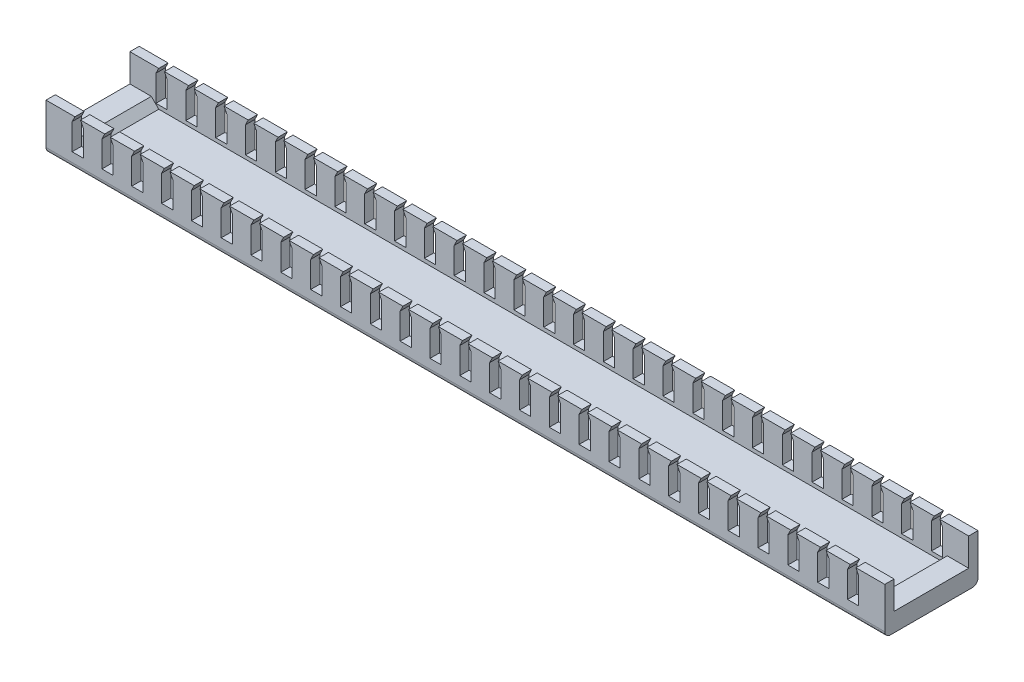
from build123d import *

# Parameters (mm, degrees)
PROFILEBOSS_EXTRUDE1_DEPTH             = 225
SPIKESCUT_EXTRUDE1_DEPTH               = 227.72946434
MOUNTHOLETHICKNESSSKETCH4_W            = 7.75
MOUNTHOLETHICKNESSSKETCH4_H            = 20
MOUNTHOLESTHICKNESSBOSS_EXTRUDE1_DEPTH = 2
MOUNTHOLESSKETCH5_R                    = 2.05
MOUNTHOLESCUT_EXTRUDE2_DEPTH           = 4
CHAMFER1_SIZE                          = 2


with BuildPart() as part:
    # Sketch2 → ProfileBoss-Extrude1 (new body)
    with BuildSketch(Plane(origin=(0, 0, 0), x_dir=(0, 0, -1), z_dir=(1, 0, 0))):
        with BuildLine():
            Line((1.5, 0), (23.5, 0))
            ThreePointArc((23.5, 0), (24.560660172, 0.439339828), (25, 1.5))
            Line((25, 1.5), (25, 12.5))
            Line((25, 12.5), (22.5, 12.5))
            Line((22.5, 12.5), (22.5, 3))
            Line((22.5, 3), (2.5, 3))
            Line((2.5, 3), (2.5, 12.5))
            Line((2.5, 12.5), (0, 12.5))
            Line((0, 12.5), (0, 1.5))
            ThreePointArc((0, 1.5), (0.439339828, 0.439339828), (1.5, 0))
        make_face()
    extrude(amount=PROFILEBOSS_EXTRUDE1_DEPTH)

    # Sketch3 → SpikesCut-Extrude1 (cut, through all)
    with BuildSketch(Plane.XY):
        Polygon((7.75, 12.5), (7, 11), (7, 4), (10, 4), (10, 11), (9.25, 12.5), align=None)
        Polygon((15.75, 12.5), (15, 11), (15, 4), (18, 4), (18, 11), (17.25, 12.5), align=None)
        Polygon((23.75, 12.5), (23, 11), (23, 4), (26, 4), (26, 11), (25.25, 12.5), align=None)
        Polygon((31.75, 12.5), (31, 11), (31, 4), (34, 4), (34, 11), (33.25, 12.5), align=None)
        Polygon((39.75, 12.5), (39, 11), (39, 4), (42, 4), (42, 11), (41.25, 12.5), align=None)
        Polygon((47.75, 12.5), (47, 11), (47, 4), (50, 4), (50, 11), (49.25, 12.5), align=None)
        Polygon((55.75, 12.5), (55, 11), (55, 4), (58, 4), (58, 11), (57.25, 12.5), align=None)
        Polygon((63.75, 12.5), (63, 11), (63, 4), (66, 4), (66, 11), (65.25, 12.5), align=None)
        Polygon((71.75, 12.5), (71, 11), (71, 4), (74, 4), (74, 11), (73.25, 12.5), align=None)
        Polygon((79.75, 12.5), (79, 11), (79, 4), (82, 4), (82, 11), (81.25, 12.5), align=None)
        Polygon((87.75, 12.5), (87, 11), (87, 4), (90, 4), (90, 11), (89.25, 12.5), align=None)
        Polygon((95.75, 12.5), (95, 11), (95, 4), (98, 4), (98, 11), (97.25, 12.5), align=None)
        Polygon((103.75, 12.5), (103, 11), (103, 4), (106, 4), (106, 11), (105.25, 12.5), align=None)
        Polygon((111.75, 12.5), (111, 11), (111, 4), (114, 4), (114, 11), (113.25, 12.5), align=None)
        Polygon((119.75, 12.5), (119, 11), (119, 4), (122, 4), (122, 11), (121.25, 12.5), align=None)
        Polygon((127.75, 12.5), (127, 11), (127, 4), (130, 4), (130, 11), (129.25, 12.5), align=None)
        Polygon((135.75, 12.5), (135, 11), (135, 4), (138, 4), (138, 11), (137.25, 12.5), align=None)
        Polygon((143.75, 12.5), (143, 11), (143, 4), (146, 4), (146, 11), (145.25, 12.5), align=None)
        Polygon((151.75, 12.5), (151, 11), (151, 4), (154, 4), (154, 11), (153.25, 12.5), align=None)
        Polygon((159.75, 12.5), (159, 11), (159, 4), (162, 4), (162, 11), (161.25, 12.5), align=None)
        Polygon((167.75, 12.5), (167, 11), (167, 4), (170, 4), (170, 11), (169.25, 12.5), align=None)
        Polygon((175.75, 12.5), (175, 11), (175, 4), (178, 4), (178, 11), (177.25, 12.5), align=None)
        Polygon((183.75, 12.5), (183, 11), (183, 4), (186, 4), (186, 11), (185.25, 12.5), align=None)
        Polygon((191.75, 12.5), (191, 11), (191, 4), (194, 4), (194, 11), (193.25, 12.5), align=None)
        Polygon((199.75, 12.5), (199, 11), (199, 4), (202, 4), (202, 11), (201.25, 12.5), align=None)
        Polygon((207.75, 12.5), (207, 11), (207, 4), (210, 4), (210, 11), (209.25, 12.5), align=None)
        Polygon((215.75, 12.5), (215, 11), (215, 4), (218, 4), (218, 11), (217.25, 12.5), align=None)
    extrude(amount=-SPIKESCUT_EXTRUDE1_DEPTH, mode=Mode.SUBTRACT)

    # MountHoleThicknessSketch4 → MountHolesThicknessBoss-Extrude1 (add)
    with BuildSketch(Plane(origin=(0, 3, 0), x_dir=(1, 0, 0), z_dir=(0, 1, 0))):
        with Locations((3.875, 12.5)):
            Rectangle(MOUNTHOLETHICKNESSSKETCH4_W, MOUNTHOLETHICKNESSSKETCH4_H)
        with Locations((221.125, 12.5)):
            Rectangle(MOUNTHOLETHICKNESSSKETCH4_W, MOUNTHOLETHICKNESSSKETCH4_H)
    extrude(amount=MOUNTHOLESTHICKNESSBOSS_EXTRUDE1_DEPTH)

    # MountHolesSketch5 → MountHolesCut-Extrude2 (cut)
    with BuildSketch(Plane(origin=(0, 3, 0), x_dir=(1, 0, 0), z_dir=(0, 1, 0))):
        with Locations(Location((5, 12.5, 0), (0, 0, 270))):
            Circle(MOUNTHOLESSKETCH5_R)
        with Locations(Location((220, 12.5, 0), (0, 0, 270))):
            Circle(MOUNTHOLESSKETCH5_R)
    extrude(amount=-MOUNTHOLESCUT_EXTRUDE2_DEPTH, mode=Mode.SUBTRACT)

    # Chamfer1
    # the kernel refuses this chamfer: 2 mm, written as the material it takes off along each edge
    with BuildSketch(Plane(origin=(217.25, 5, -22.5), x_dir=(0.9996219169112968, 0.027495876610586605, 0), z_dir=(0, 0, 1))) as chamfer1_piece_1:
        Polygon((CHAMFER1_SIZE * 0.999621916911, -CHAMFER1_SIZE * 0.0274958766106), (-CHAMFER1_SIZE * 0.0274958766106, -CHAMFER1_SIZE * 0.999621916911), (0, 0), align=None)
    extrude(amount=20, mode=Mode.SUBTRACT)
    with BuildSketch(Plane(origin=(7.75, 5, -22.5), x_dir=(-0.9996219169112968, 0.027495876610586487, 0), z_dir=(0, 0, 1))) as chamfer1_piece_2:
        Polygon((CHAMFER1_SIZE * 0.999621916911, CHAMFER1_SIZE * 0.0274958766106), (-CHAMFER1_SIZE * 0.0274958766106, CHAMFER1_SIZE * 0.999621916911), (0, 0), align=None)
    extrude(amount=20, mode=Mode.SUBTRACT)


solid = part.part
